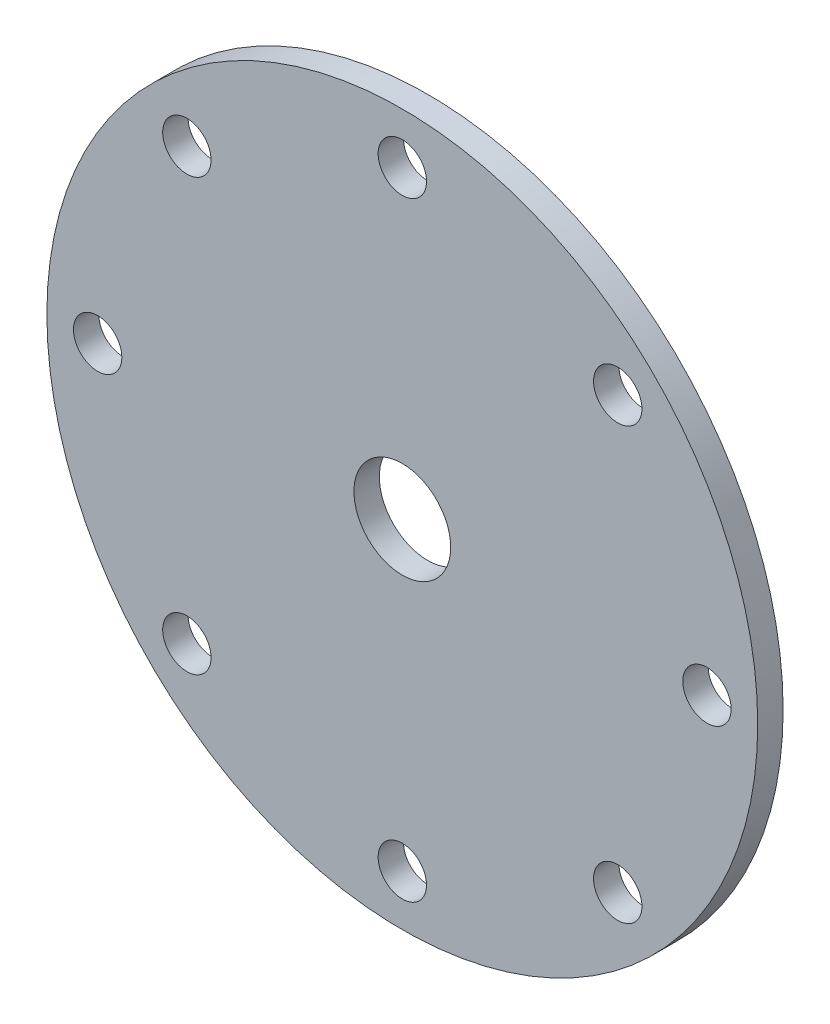
from build123d import *

# Parameters (mm, degrees)
SKETCH1_R        = 70
SKETCH1_R_2      = 4.7625
SKETCH1_R_3      = 9.525
ROTOR_DISC_DEPTH = 5


with BuildPart() as part:
    # Sketch1 → Rotor Disc (new body)
    with BuildSketch(Plane.XY):
        Circle(SKETCH1_R)
        with Locations((-42.426406871, -42.426406871)):
            Circle(SKETCH1_R_2, mode=Mode.SUBTRACT)
        with Locations((-60, 0)):
            Circle(SKETCH1_R_2, mode=Mode.SUBTRACT)
        with Locations((0, -60)):
            Circle(SKETCH1_R_2, mode=Mode.SUBTRACT)
        with Locations((42.426406871, -42.426406871)):
            Circle(SKETCH1_R_2, mode=Mode.SUBTRACT)
        with Locations((-42.426406871, 42.426406871)):
            Circle(SKETCH1_R_2, mode=Mode.SUBTRACT)
        Circle(SKETCH1_R_3, mode=Mode.SUBTRACT)
        with Locations((60, 0)):
            Circle(SKETCH1_R_2, mode=Mode.SUBTRACT)
        with Locations((0, 60)):
            Circle(SKETCH1_R_2, mode=Mode.SUBTRACT)
        with Locations((42.426406871, 42.426406871)):
            Circle(SKETCH1_R_2, mode=Mode.SUBTRACT)
    extrude(amount=ROTOR_DISC_DEPTH)


solid = part.part
